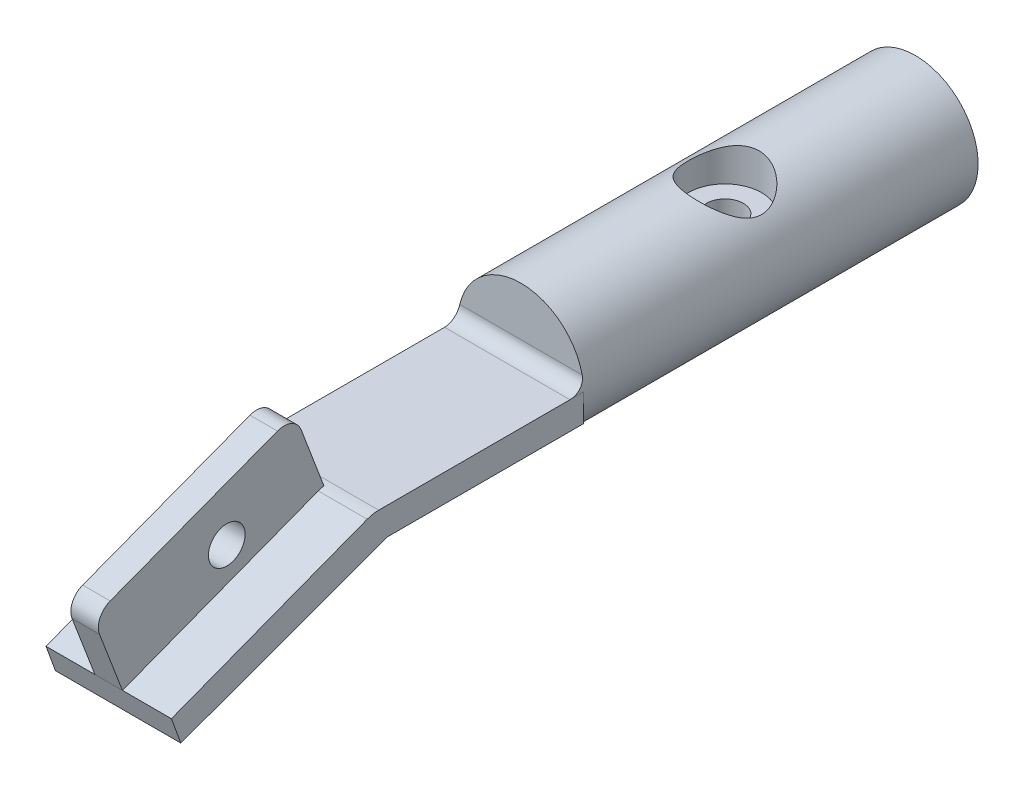
from build123d import *

# Parameters (mm, degrees)
SKETCH1_W           = 46
SKETCH1_H           = 6
BOSS_EXTRUDE1_DEPTH = 27.35
BOSS_EXTRUDE2_DEPTH = 27.35
FILLET1_R           = 7
BOSS_EXTRUDE3_DEPTH = 86
FILLET2_R           = 3
SKETCH5_R           = 8
SKETCH5_R_2         = 4
CUT_EXTRUDE1_DEPTH  = 116.185263628
SKETCH6_R           = 4
CUT_EXTRUDE2_DEPTH  = 116.185263741
SKETCH7_R           = 4
CUT_EXTRUDE3_DEPTH  = 116.185263741
SKETCH8_R           = 8
SKETCH8_R_2         = 4
BOSS_EXTRUDE4_DEPTH = 6
SKETCH9_R           = 8
SKETCH9_R_2         = 4
BOSS_EXTRUDE5_DEPTH = 6
SKETCH11_R          = 4
BOSS_EXTRUDE6_DEPTH = 3


with BuildPart() as part:
    # Sketch1 → Boss-Extrude1 (new body)
    with BuildSketch(Plane(origin=(0, 0, 0), x_dir=(0, 0, -1), z_dir=(1, 0, 0))):
        with Locations((1.147704591, 3)):
            Rectangle(SKETCH1_W, SKETCH1_H)
    extrude(amount=-BOSS_EXTRUDE1_DEPTH)

    # Sketch2 → Boss-Extrude2 (add)
    with BuildSketch(Plane(origin=(0, 0, 0), x_dir=(0, 0, -1), z_dir=(1, 0, 0))):
        Polygon((-21.852295409, 6), (-65.755273625, -10.778811155), (-63.703152765, -16.41696688), (-18.597906967, 0), align=None)
    extrude(amount=-BOSS_EXTRUDE2_DEPTH)

    # Fillet1
    fillet1_edges = [part.edges().sort_by_distance(p)[0] for p in [
        (-13.675, 6, 21.852295409),
    ]]
    fillet(fillet1_edges, radius=FILLET1_R)

    # Sketch3 → Boss-Extrude3 (add)
    with BuildSketch(Plane(origin=(0, 0, -24.147704591), x_dir=(-1, 0, 0), z_dir=(0, 0, -1))):
        with BuildLine():
            ThreePointArc((27.35, 6), (13.675, 19.675), (0, 6))
            Line((0, 6), (27.35, 6))
        make_face()
        with BuildLine():
            Line((25.963434603, 0), (1.386565397, 0))
            ThreePointArc((1.386565397, 0), (13.675, -7.675), (25.963434603, 0))
        make_face()
        with BuildLine():
            Line((27.35, 6), (0, 6))
            ThreePointArc((0, 6), (0.351149802, 2.920935061), (1.386565397, 0))
            Line((1.386565397, 0), (25.963434603, 0))
            ThreePointArc((25.963434603, 0), (26.998850198, 2.920935061), (27.35, 6))
        make_face()
    extrude(amount=BOSS_EXTRUDE3_DEPTH)

    # Fillet2
    # the kernel refuses this fillet: 3 mm, written as the material it adds along each edge
    with BuildSketch(Plane(origin=(0, 6, -24.147704591), x_dir=(0, 0, 1), z_dir=(-1, 0, 0))) as fillet2_piece_1_section:
        with BuildLine():
            CenterArc((FILLET2_R, FILLET2_R), FILLET2_R, 180, 90)
            Line((0, FILLET2_R), (0, 0))
            Line((0, 0), (FILLET2_R, 0))
        make_face()
    fillet2_piece_1 = extrude(amount=27.35, mode=Mode.PRIVATE)
    fillet2_piece_1 = fillet2_piece_1 & Plane(origin=(-13.675, 6, -23.467343504), x_dir=(-1, 0, 0), z_dir=(0, 0, 1)) * Cylinder(13.675, 67, mode=Mode.PRIVATE)
    add(fillet2_piece_1)

    # Sketch5 → Cut-Extrude1 (cut, through all)
    with BuildSketch(Plane(origin=(0, 0, 0), x_dir=(1, 0, 0), z_dir=(0, 1, 0))):
        with Locations(Location((-12.203148076, 67.147704591, 0), (0, 0, 259.398243128))):
            Circle(SKETCH5_R)
        with Locations(Location((-12.203148076, 67.147704591, 0), (0, 0, 248.409956221))):
            Circle(SKETCH5_R_2, mode=Mode.SUBTRACT)
    extrude(amount=CUT_EXTRUDE1_DEPTH, mode=Mode.SUBTRACT)

    # Sketch6 → Cut-Extrude2 (cut, through all)
    with BuildSketch(Plane(origin=(0, 0, 0), x_dir=(1, 0, 0), z_dir=(0, 1, 0))):
        with Locations((-12.203148076, 67.147704591)):
            Circle(SKETCH6_R)
    extrude(amount=CUT_EXTRUDE2_DEPTH, mode=Mode.SUBTRACT)

    # Sketch7 → Cut-Extrude3 (cut, through all)
    with BuildSketch(Plane(origin=(0, 0, 0), x_dir=(1, 0, 0), z_dir=(0, 1, 0))):
        with Locations(Location((-12.203148076, 67.147704591, 0), (0, 0, 270))):
            Circle(SKETCH7_R)
    extrude(amount=-CUT_EXTRUDE3_DEPTH, mode=Mode.SUBTRACT)

    # Sketch8 → Boss-Extrude4 (add)
    with BuildSketch(Plane(origin=(0, 0, 0), x_dir=(1, 0, 0), z_dir=(0, 1, 0))):
        with Locations(Location((-12.203148076, 67.147704591, 0), (0, 0, 259.398243128))):
            Circle(SKETCH8_R)
        with Locations(Location((-12.203148076, 67.147704591, 0), (0, 0, 270))):
            Circle(SKETCH8_R_2, mode=Mode.SUBTRACT)
    extrude(amount=BOSS_EXTRUDE4_DEPTH)

    # Sketch9 → Boss-Extrude5 (add)
    with BuildSketch(Plane(origin=(0, 6, 0), x_dir=(1, 0, 0), z_dir=(0, 1, 0))):
        with Locations(Location((-12.203148076, 67.147704591, 0), (0, 0, 259.398243128))):
            Circle(SKETCH9_R)
        with Locations(Location((-12.203148076, 67.147704591, 0), (0, 0, 270))):
            Circle(SKETCH9_R_2, mode=Mode.SUBTRACT)
    extrude(amount=BOSS_EXTRUDE5_DEPTH)


with BuildPart() as part_1:
    # Body-Move/Copy1: moved
    add(part.part.moved(Location((13.675, 0, 0))))

    # Sketch11 → Boss-Extrude6 (add, symmetric)
    with BuildSketch(Plane(origin=(0, 0, 0), x_dir=(0, 0, -1), z_dir=(1, 0, 0))):
        with BuildLine():
            Line((-65.755273625, -10.778811155), (-21.830832444, 5.883719563))
            Line((-21.830832444, 5.883719563), (-26.796391829, 18.97353316))
            ThreePointArc((-26.796391829, 18.97353316), (-28.894991358, 21.202538099), (-31.955069824, 21.294748649))
            Line((-31.955069824, 21.294748649), (-68.432005738, 7.457394118))
            ThreePointArc((-68.432005738, 7.457394118), (-70.663039196, 5.354278937), (-70.749698163, 2.289463448))
            Line((-70.749698163, 2.289463448), (-65.755273625, -10.778811155))
        make_face()
        with Locations((-43.013345846, 5.334970097)):
            Circle(SKETCH11_R, mode=Mode.SUBTRACT)
    extrude(amount=BOSS_EXTRUDE6_DEPTH, both=True)


solid = part_1.part
